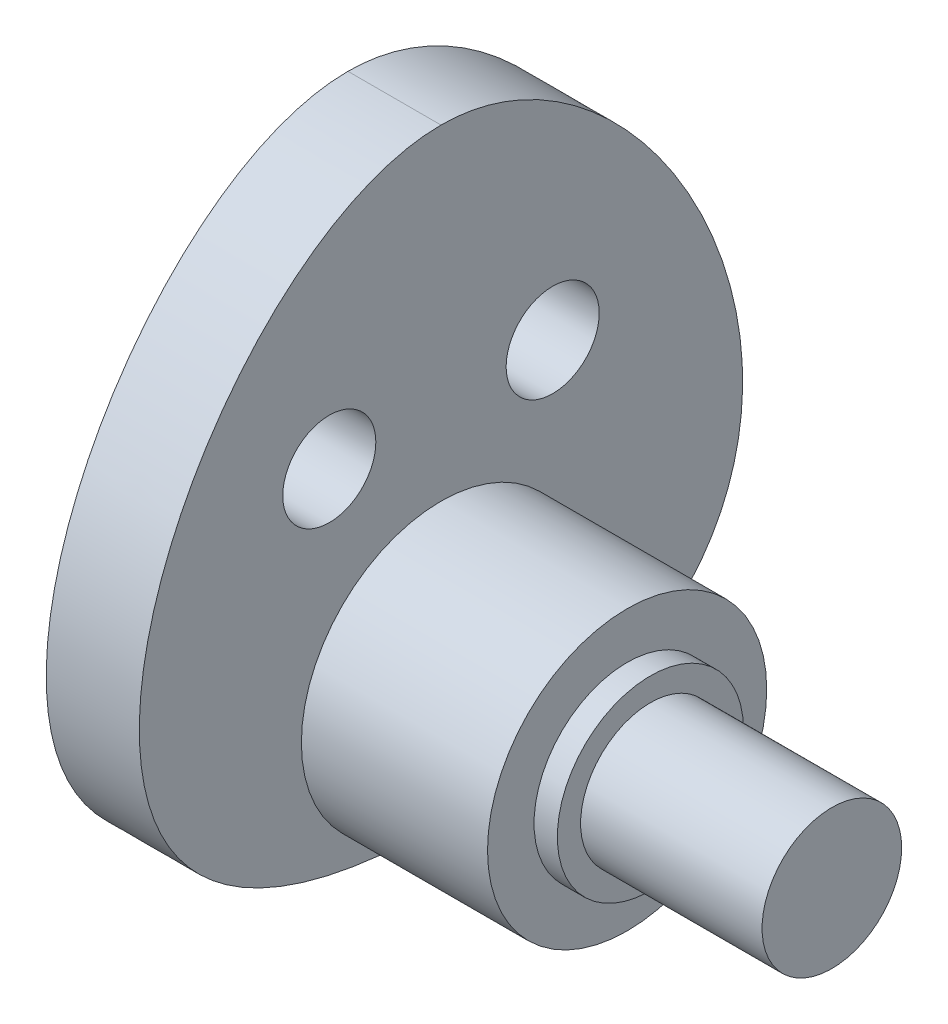
from build123d import *

# Parameters (mm, degrees)
SKETCH1_R           = 2.5
BOSS_EXTRUDE1_DEPTH = 2
SKETCH2_R           = 3
BOSS_EXTRUDE2_DEPTH = 7.5
CUT_EXTRUDE1_REACH  = 17.241
SKETCH3_R           = 1
CHAMFER1_SIZE       = 1
SKETCH4_OUTSIDE_W   = 19.1
SKETCH4_OUTSIDE_H   = 19.134
SKETCH4_OUTSIDE_R   = 1.5
CUT_EXTRUDE2_DEPTH  = 3
SKETCH5_OUTSIDE_W   = 19.1
SKETCH5_OUTSIDE_H   = 19.134
SKETCH5_OUTSIDE_R   = 2
CUT_EXTRUDE3_DEPTH  = 0.5
BOSS_EXTRUDE3_START = 0.9
SKETCH6_R           = 1.5
BOSS_EXTRUDE3_DEPTH = 0.9


with BuildPart() as part:
    # Sketch1 → Boss-Extrude1 (new body)
    with BuildSketch(Plane(origin=(0, 0, 0), x_dir=(0, 0, -1), z_dir=(1, 0, 0))):
        with BuildLine():
            add(Edge.make_bspline(
                [(0, 10), (-5.575397586, 10), (-11.256765776, -3), (0, -3)],
                knots=[0, 0, 0, 0, 1, 1, 1, 1], degree=3))
            add(Edge.make_bspline(
                [(0, 10), (5.575397586, 10), (11.256765776, -3), (0, -3)],
                knots=[0, 0, 0, 0, 1, 1, 1, 1], degree=3))
        make_face()
        Circle(SKETCH1_R, mode=Mode.SUBTRACT)
    extrude(amount=BOSS_EXTRUDE1_DEPTH)

    # Sketch2 → Boss-Extrude2 (add)
    with BuildSketch(Plane(origin=(2, 0, 0), x_dir=(0, 0, -1), z_dir=(1, 0, 0))):
        Circle(SKETCH2_R)
    extrude(amount=BOSS_EXTRUDE2_DEPTH)

    # Sketch3 → Cut-Extrude1 (cut, up to next)
    with BuildSketch(Plane.ZY, mode=Mode.PRIVATE) as cut_extrude1_sk1:
        with Locations((-2.4, 4.8)):
            Circle(SKETCH3_R)
    cut_extrude1_tool1 = extrude(cut_extrude1_sk1.sketch, amount=-CUT_EXTRUDE1_REACH, mode=Mode.PRIVATE) & part.part
    # Sketch3 → Cut-Extrude1 (cut, up to next)
    with BuildSketch(Plane.ZY, mode=Mode.PRIVATE) as cut_extrude1_sk2:
        with Locations((2.4, 4.8)):
            Circle(SKETCH3_R)
    cut_extrude1_tool2 = extrude(cut_extrude1_sk2.sketch, amount=-CUT_EXTRUDE1_REACH, mode=Mode.PRIVATE) & part.part
    add(cut_extrude1_tool1.solids().sort_by_distance((0, 4.8, -2.4))[0], mode=Mode.SUBTRACT)
    add(cut_extrude1_tool2.solids().sort_by_distance((0, 4.8, 2.4))[0], mode=Mode.SUBTRACT)

    # Chamfer1
    chamfer1_edges = [part.edges().sort_by_distance(p)[0] for p in [
        (2, 0, 2.5),
    ]]
    chamfer(chamfer1_edges, length=CHAMFER1_SIZE)

    # Sketch4 outside → Cut-Extrude2 (cut)
    with BuildSketch(Plane(origin=(9.5, 0, 0), x_dir=(0, 0, -1), z_dir=(1, 0, 0))):
        with Locations((0, 3.5)):
            Rectangle(SKETCH4_OUTSIDE_W, SKETCH4_OUTSIDE_H)
        Circle(SKETCH4_OUTSIDE_R, mode=Mode.SUBTRACT)
    extrude(amount=-CUT_EXTRUDE2_DEPTH, mode=Mode.SUBTRACT)

    # Sketch5 outside → Cut-Extrude3 (cut)
    with BuildSketch(Plane(origin=(6.5, 0, 0), x_dir=(0, 0, -1), z_dir=(1, 0, 0))):
        with Locations((0, 3.5)):
            Rectangle(SKETCH5_OUTSIDE_W, SKETCH5_OUTSIDE_H)
        Circle(SKETCH5_OUTSIDE_R, mode=Mode.SUBTRACT)
    extrude(amount=-CUT_EXTRUDE3_DEPTH, mode=Mode.SUBTRACT)

    # Sketch6 → Boss-Extrude3 (add)
    with BuildSketch(Plane(origin=(9.5, 0, 0), x_dir=(0, 0, -1), z_dir=(1, 0, 0)).offset(BOSS_EXTRUDE3_START)):
        Circle(SKETCH6_R)
    extrude(amount=-BOSS_EXTRUDE3_DEPTH)


solid = part.part
